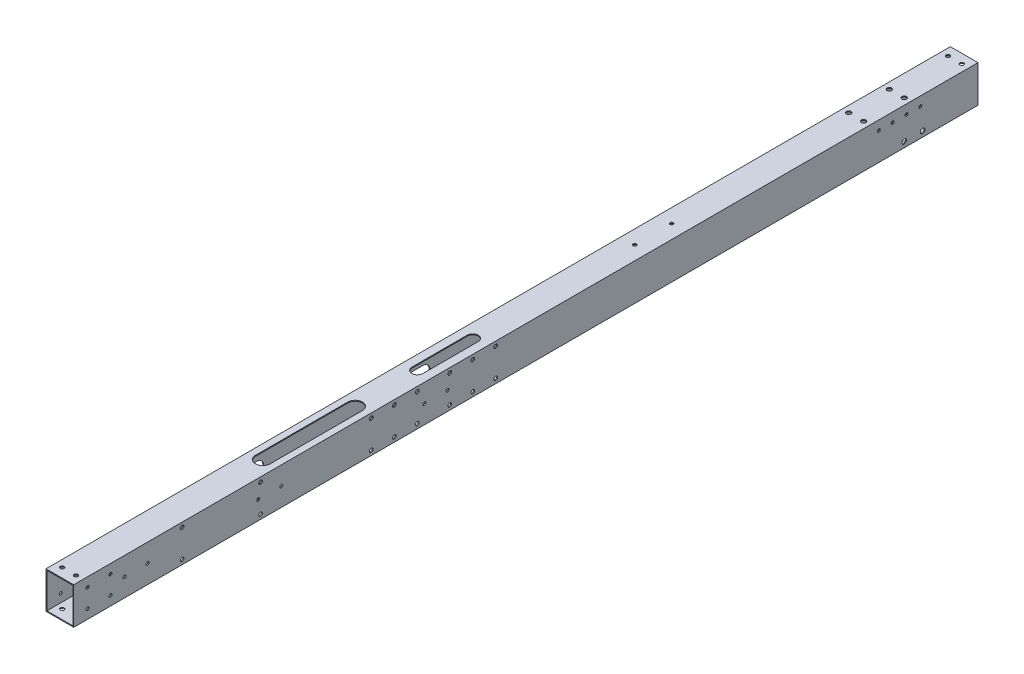
from build123d import *

# Parameters (mm, degrees)
SKETCH_1_W           = 30
SKETCH_1_H           = 40
SKETCH_1_W_2         = 28
SKETCH_1_H_2         = 38
EXTRUDE_1_DEPTH      = 940
SKETCH_5_R           = 2.5
CUT_EXTRUDE_3_DEPTH  = 941.97024395
CUT_EXTRUDE_4_DEPTH  = 1
SKETCH_7_R           = 1.5
CUT_EXTRUDE_5_DEPTH  = 1
SKETCH_17_W          = 30
SKETCH_17_H          = 40
SKETCH_17_W_2        = 28
SKETCH_17_H_2        = 38
EXTRUDE_2_DEPTH      = 20
SKETCH_18_W          = 30
SKETCH_18_H          = 40
SKETCH_18_W_2        = 28
SKETCH_18_H_2        = 38
EXTRUDE_3_DEPTH      = 20
SKETCH_19_R          = 2.1
CUT_EXTRUDE_16_DEPTH = 961.950050731
SKETCH_20_R          = 1.6
CUT_EXTRUDE_17_DEPTH = 961.67684473
SKETCH_21_R          = 2.5
SKETCH_21_R_2        = 1.6
CUT_EXTRUDE_18_DEPTH = 961.67684473
SKETCH_23_R          = 2.5
CUT_EXTRUDE_19_DEPTH = 961.950050731
SKETCH_24_R          = 4.5
CUT_EXTRUDE_20_DEPTH = 10
SKETCH_25_W          = 114.67616049
SKETCH_25_H          = 1154.562704257
CUT_EXTRUDE_21_DEPTH = 968.690549711
SKETCH_26_R          = 2
CUT_EXTRUDE_22_DEPTH = 961.67684473
CUT_EXTRUDE_23_DEPTH = 10
SKETCH_29_R          = 1.5
CUT_EXTRUDE_25_DEPTH = 10
CUT_EXTRUDE_26_DEPTH = 10
SKETCH_31_R          = 1.75
CUT_EXTRUDE_27_DEPTH = 10
SKETCH_34_W          = 70
SKETCH_34_H          = 15
CUT_EXTRUDE_28_DEPTH = 10
EXTRUDE_4_DEPTH      = 1
SKETCH_36_W          = 50.706907747
SKETCH_36_H          = 15.381529857
EXTRUDE_5_DEPTH      = 1
FILLET_1_R           = 3
SKETCH_37_R          = 1.75
CUT_EXTRUDE_29_DEPTH = 81
SKETCH_39_W          = 33.04876618
SKETCH_39_H          = 8.235453061
SKETCH_39_W_2        = 28.839368921
SKETCH_39_H_2        = 9.938064258
EXTRUDE_6_DEPTH      = 1
SKETCH_41_W          = 53.968695117
SKETCH_41_H          = 20.437849039
SKETCH_41_W_2        = 57.741002254
SKETCH_41_H_2        = 19.227533359
EXTRUDE_7_DEPTH      = 1
SKETCH_38_R          = 1.65
CUT_EXTRUDE_30_DEPTH = 93
CUT_EXTRUDE_31_DEPTH = 1
SKETCH_43_R          = 1.15
CUT_EXTRUDE_32_DEPTH = 1


with BuildPart() as part:
    # 草图1 → 凸台-拉伸1 (new body)
    with BuildSketch(Plane.XY):
        Rectangle(SKETCH_1_W, SKETCH_1_H)
        Rectangle(SKETCH_1_W_2, SKETCH_1_H_2, mode=Mode.SUBTRACT)
    extrude(amount=EXTRUDE_1_DEPTH)

    # 草图5 → 切除-拉伸3 (cut, through all)
    with BuildSketch(Plane.XZ.offset(20)):
        with Locations((-8, 53)):
            Circle(SKETCH_5_R)
        with Locations((8, 53)):
            Circle(SKETCH_5_R)
        with Locations((-8, 97)):
            Circle(SKETCH_5_R)
        with Locations((8, 97)):
            Circle(SKETCH_5_R)
    extrude(amount=-CUT_EXTRUDE_3_DEPTH, mode=Mode.SUBTRACT)

    # 草图6 → 切除-拉伸4 (cut)
    with BuildSketch(Plane(origin=(15, 0, 0), x_dir=(0, 0, -1), z_dir=(1, 0, 0))):
        with BuildLine():
            Line((-345, -7.5), (-375, -7.5))
            ThreePointArc((-375, -7.5), (-382.5, 0), (-375, 7.5))
            Line((-375, 7.5), (-345, 7.5))
            ThreePointArc((-345, 7.5), (-337.5, 0), (-345, -7.5))
        make_face()
        with BuildLine():
            Line((-525, -7.5), (-555, -7.5))
            ThreePointArc((-555, -7.5), (-562.5, 0), (-555, 7.5))
            Line((-555, 7.5), (-525, 7.5))
            ThreePointArc((-525, 7.5), (-517.5, 0), (-525, -7.5))
        make_face()
        with BuildLine():
            Line((-705, -7.5), (-735, -7.5))
            ThreePointArc((-735, -7.5), (-742.5, 0), (-735, 7.5))
            Line((-735, 7.5), (-705, 7.5))
            ThreePointArc((-705, 7.5), (-697.5, 0), (-705, -7.5))
        make_face()
    extrude(amount=-CUT_EXTRUDE_4_DEPTH, mode=Mode.SUBTRACT)

    # 草图7 → 切除-拉伸5 (cut)
    with BuildSketch(Plane.ZY.offset(15)):
        with Locations((350, 0)):
            Circle(SKETCH_7_R)
        with Locations((370, 0)):
            Circle(SKETCH_7_R)
        with Locations((530, 0)):
            Circle(SKETCH_7_R)
        with Locations((550, 0)):
            Circle(SKETCH_7_R)
        with Locations((710, 0)):
            Circle(SKETCH_7_R)
        with Locations((730, 0)):
            Circle(SKETCH_7_R)
    extrude(amount=-CUT_EXTRUDE_5_DEPTH, mode=Mode.SUBTRACT)

    # 草图17 → 凸台-拉伸2 (add)
    with BuildSketch(Plane.XY.offset(940)):
        Rectangle(SKETCH_17_W, SKETCH_17_H)
        Rectangle(SKETCH_17_W_2, SKETCH_17_H_2, mode=Mode.SUBTRACT)
    extrude(amount=EXTRUDE_2_DEPTH)

    # 草图18 → 凸台-拉伸3 (add)
    with BuildSketch(Plane(origin=(0, 0, 0), x_dir=(-1, 0, 0), z_dir=(0, 0, -1))):
        Rectangle(SKETCH_18_W, SKETCH_18_H)
        Rectangle(SKETCH_18_W_2, SKETCH_18_H_2, mode=Mode.SUBTRACT)
    extrude(amount=EXTRUDE_3_DEPTH)

    # 草图19 → 切除-拉伸16 (cut, through all)
    with BuildSketch(Plane(origin=(0, 20, 0), x_dir=(1, 0, 0), z_dir=(0, 1, 0))):
        with Locations((-7.5, -950)):
            Circle(SKETCH_19_R)
        with Locations((7.5, -950)):
            Circle(SKETCH_19_R)
        with Locations((-7.5, 10)):
            Circle(SKETCH_19_R)
        with Locations((7.5, 10)):
            Circle(SKETCH_19_R)
    extrude(amount=-CUT_EXTRUDE_16_DEPTH, mode=Mode.SUBTRACT)

    # 草图20 → 切除-拉伸17 (cut, through all)
    with BuildSketch(Plane(origin=(15, 0, 0), x_dir=(0, 0, -1), z_dir=(1, 0, 0))):
        with Locations((-945, 10)):
            Circle(SKETCH_20_R)
        with Locations((-920, 10)):
            Circle(SKETCH_20_R)
        with Locations((-920, -10)):
            Circle(SKETCH_20_R)
        with Locations((-945, -10)):
            Circle(SKETCH_20_R)
    extrude(amount=-CUT_EXTRUDE_17_DEPTH, mode=Mode.SUBTRACT)

    # 草图21 → 切除-拉伸18 (cut, through all)
    with BuildSketch(Plane(origin=(15, 0, 0), x_dir=(0, 0, -1), z_dir=(1, 0, 0))):
        with Locations((-40, -14)):
            Circle(SKETCH_21_R)
        with Locations((-60, -14)):
            Circle(SKETCH_21_R)
        with Locations((-42.5, 10)):
            Circle(SKETCH_21_R_2)
        with Locations((-57.5, 10)):
            Circle(SKETCH_21_R_2)
        with Locations((-72.5, 10)):
            Circle(SKETCH_21_R_2)
        with Locations((-87.5, 10)):
            Circle(SKETCH_21_R_2)
    extrude(amount=-CUT_EXTRUDE_18_DEPTH, mode=Mode.SUBTRACT)

    # 草图23 → 切除-拉伸19 (cut, through all)
    with BuildSketch(Plane(origin=(0, 20, 0), x_dir=(1, 0, 0), z_dir=(0, 1, 0))):
        with Locations((0, -520)):
            Circle(SKETCH_23_R)
        with Locations((0, -535)):
            Circle(SKETCH_23_R)
        with Locations((0, -550)):
            Circle(SKETCH_23_R)
        with Locations((0, -565)):
            Circle(SKETCH_23_R)
    extrude(amount=-CUT_EXTRUDE_19_DEPTH, mode=Mode.SUBTRACT)

    # 草图24 → 切除-拉伸20 (cut)
    with BuildSketch(Plane(origin=(0, 20, 0), x_dir=(1, 0, 0), z_dir=(0, 1, 0))):
        with Locations((0, -520)):
            Circle(SKETCH_24_R)
        with Locations((0, -535)):
            Circle(SKETCH_24_R)
        with Locations((0, -550)):
            Circle(SKETCH_24_R)
        with Locations((0, -565)):
            Circle(SKETCH_24_R)
    extrude(amount=-CUT_EXTRUDE_20_DEPTH, mode=Mode.SUBTRACT)


with BuildPart() as body_2:
    # 镜向2: mirrored copy
    add(part.part.mirror(Plane(origin=(-50, 0, 0), x_dir=(0, 0, 1), z_dir=(1, 0, 0))))

    # 草图26 → 切除-拉伸22 (cut, through all)
    with BuildSketch(Plane.ZY.offset(115)):
        with Locations((612.5, 15)):
            Circle(SKETCH_26_R)
        with Locations((612.5, -15)):
            Circle(SKETCH_26_R)
        with Locations((527.5, 15)):
            Circle(SKETCH_26_R)
        with Locations((527.5, -15)):
            Circle(SKETCH_26_R)
        with Locations((842.5, 15)):
            Circle(SKETCH_26_R)
        with Locations((842.5, -15)):
            Circle(SKETCH_26_R)
        with Locations((757.5, 15)):
            Circle(SKETCH_26_R)
        with Locations((757.5, -15)):
            Circle(SKETCH_26_R)
        with Locations((637.5, 15)):
            Circle(SKETCH_26_R)
        with Locations((637.5, -15)):
            Circle(SKETCH_26_R)
        with Locations((552.5, -15)):
            Circle(SKETCH_26_R)
        with Locations((552.5, 15)):
            Circle(SKETCH_26_R)
        with Locations((502.5, 15)):
            Circle(SKETCH_26_R)
        with Locations((502.5, -15)):
            Circle(SKETCH_26_R)
        with Locations((587.5, -15)):
            Circle(SKETCH_26_R)
        with Locations((587.5, 15)):
            Circle(SKETCH_26_R)
    extrude(amount=-CUT_EXTRUDE_22_DEPTH, mode=Mode.SUBTRACT)

    # 草图27 → 切除-拉伸23 (cut)
    with BuildSketch(Plane(origin=(0, 20, 0), x_dir=(1, 0, 0), z_dir=(0, 1, 0))):
        with BuildLine():
            Line((-94, -512.5), (-94, -572.5))
            ThreePointArc((-94, -572.5), (-100, -578.5), (-106, -572.5))
            Line((-106, -572.5), (-106, -512.5))
            ThreePointArc((-106, -512.5), (-100, -506.5), (-94, -512.5))
        make_face()
    extrude(amount=-CUT_EXTRUDE_23_DEPTH, mode=Mode.SUBTRACT)

    # 草图29 → 切除-拉伸25 (cut)
    with BuildSketch(Plane.XZ.offset(20)):
        with Locations((-105, 740)):
            Circle(SKETCH_29_R)
        with Locations((-105, 720)):
            Circle(SKETCH_29_R)
        with Locations((-105, 700)):
            Circle(SKETCH_29_R)
        with Locations((-105, 680)):
            Circle(SKETCH_29_R)
        with Locations((-105, 660)):
            Circle(SKETCH_29_R)
        with Locations((-105, 640)):
            Circle(SKETCH_29_R)
        with Locations((-105, 620)):
            Circle(SKETCH_29_R)
    extrude(amount=-CUT_EXTRUDE_25_DEPTH, mode=Mode.SUBTRACT)

    # 草图30 → 切除-拉伸26 (cut)
    with BuildSketch(Plane(origin=(0, 20, 0), x_dir=(1, 0, 0), z_dir=(0, 1, 0))):
        with BuildLine():
            Line((-92, -640), (-92, -740))
            ThreePointArc((-92, -740), (-100, -748), (-108, -740))
            Line((-108, -740), (-108, -640))
            ThreePointArc((-108, -640), (-100, -632), (-92, -640))
        make_face()
    extrude(amount=-CUT_EXTRUDE_26_DEPTH, mode=Mode.SUBTRACT)

    # 草图31 → 切除-拉伸27 (cut)
    with BuildSketch(Plane.XZ.offset(20)):
        with Locations((-100, 137)):
            Circle(SKETCH_31_R)
        with Locations((-100, 177)):
            Circle(SKETCH_31_R)
    extrude(amount=-CUT_EXTRUDE_27_DEPTH, mode=Mode.SUBTRACT)

    # 草图34 → 切除-拉伸28 (cut)
    with BuildSketch(Plane.ZY.offset(115)):
        with Locations((315, -11.5)):
            Rectangle(SKETCH_34_W, SKETCH_34_H)
    extrude(amount=-CUT_EXTRUDE_28_DEPTH, mode=Mode.SUBTRACT)

    # 草图35 → 凸台-拉伸4 (add)
    with BuildSketch(Plane.ZY.offset(115)):
        Polygon((336.145770334, -4), (350, -4), (350, -9.077366936), (391.920925018, -9.077366936), (391.920925018, 11.093373936), (336.145770334, 11.093373936), align=None)
    extrude(amount=-EXTRUDE_4_DEPTH)

    # 草图36 → 凸台-拉伸5 (add)
    with BuildSketch(Plane(origin=(-85, 0, 0), x_dir=(0, 0, -1), z_dir=(1, 0, 0))):
        with Locations((-354.422343157, -1.974054468)):
            Rectangle(SKETCH_36_W, SKETCH_36_H)
    extrude(amount=-EXTRUDE_5_DEPTH)

    # 圆角1
    fillet_1_edges = [body_2.edges().sort_by_distance(p)[0] for p in [
        (-114.5, -19, 350),
        (-114.5, -4, 350),
        (-114.5, -4, 280),
        (-114.5, -19, 280),
    ]]
    fillet(fillet_1_edges, radius=FILLET_1_R)

    # 草图37 → 切除-拉伸29 (cut)
    with BuildSketch(Plane.XZ.offset(20)):
        with Locations((-100, 297)):
            Circle(SKETCH_37_R)
        with Locations((-100, 337)):
            Circle(SKETCH_37_R)
    extrude(amount=-CUT_EXTRUDE_29_DEPTH, mode=Mode.SUBTRACT)

    # 草图39 → 凸台-拉伸6 (add)
    with BuildSketch(Plane(origin=(-85, 0, 0), x_dir=(0, 0, -1), z_dir=(1, 0, 0))):
        with Locations((-716.005404382, 0.278572404)):
            Rectangle(SKETCH_39_W, SKETCH_39_H)
        with Locations((-538.020368458, 0.344207478)):
            Rectangle(SKETCH_39_W_2, SKETCH_39_H_2)
    extrude(amount=-EXTRUDE_6_DEPTH)

    # 草图41 → 凸台-拉伸7 (add)
    with BuildSketch(Plane.ZY.offset(115)):
        with Locations((541.407114178, 0.400095075)):
            Rectangle(SKETCH_41_W, SKETCH_41_H)
        with Locations((717.500112012, 1.005252915)):
            Rectangle(SKETCH_41_W_2, SKETCH_41_H_2)
    extrude(amount=-EXTRUDE_7_DEPTH)

    # 草图38 → 切除-拉伸30 (cut)
    with BuildSketch(Plane(origin=(-85, 0, 0), x_dir=(0, 0, -1), z_dir=(1, 0, 0))):
        with Locations((-905, 0)):
            Circle(SKETCH_38_R)
        with Locations((-880, 0)):
            Circle(SKETCH_38_R)
        with Locations((-760, 0)):
            Circle(SKETCH_38_R)
        with Locations((-735, 0)):
            Circle(SKETCH_38_R)
        with Locations((-580, 0)):
            Circle(SKETCH_38_R)
        with Locations((-555, 0)):
            Circle(SKETCH_38_R)
    extrude(amount=-CUT_EXTRUDE_30_DEPTH, mode=Mode.SUBTRACT)

    # 草图42 → 切除-拉伸31 (cut)
    with BuildSketch(Plane.ZY.offset(115)):
        with BuildLine():
            Line((877.5, 7.5), (907.5, 7.5))
            ThreePointArc((907.5, 7.5), (915, 0), (907.5, -7.5))
            Line((907.5, -7.5), (877.5, -7.5))
            ThreePointArc((877.5, -7.5), (870, 0), (877.5, 7.5))
        make_face()
        with BuildLine():
            Line((732.5, 7.5), (762.5, 7.5))
            ThreePointArc((762.5, 7.5), (770, 0), (762.5, -7.5))
            Line((762.5, -7.5), (732.5, -7.5))
            ThreePointArc((732.5, -7.5), (725, 0), (732.5, 7.5))
        make_face()
        with BuildLine():
            Line((552.5, 7.5), (582.5, 7.5))
            ThreePointArc((582.5, 7.5), (590, 0), (582.5, -7.5))
            Line((582.5, -7.5), (552.5, -7.5))
            ThreePointArc((552.5, -7.5), (545, 0), (552.5, 7.5))
        make_face()
    extrude(amount=-CUT_EXTRUDE_31_DEPTH, mode=Mode.SUBTRACT)

    # 草图43 → 切除-拉伸32 (cut)
    with BuildSketch(Plane.ZY.offset(115)):
        with Locations((-14, 9)):
            Circle(SKETCH_43_R)
        with Locations((31.2, 9)):
            Circle(SKETCH_43_R)
        with Locations((31.2, -9)):
            Circle(SKETCH_43_R)
        with Locations((-14, -9)):
            Circle(SKETCH_43_R)
    extrude(amount=-CUT_EXTRUDE_32_DEPTH, mode=Mode.SUBTRACT)


with BuildPart() as part_1:
    add(part.part)

    # 草图25 → 切除-拉伸21 (cut, through all)
    with BuildSketch(Plane(origin=(0, 20, 0), x_dir=(1, 0, 0), z_dir=(0, 1, 0))):
        with Locations((7.338080245, -506.215166959)):
            Rectangle(SKETCH_25_W, SKETCH_25_H)
    extrude(amount=-CUT_EXTRUDE_21_DEPTH, mode=Mode.SUBTRACT)


solid = body_2.part
